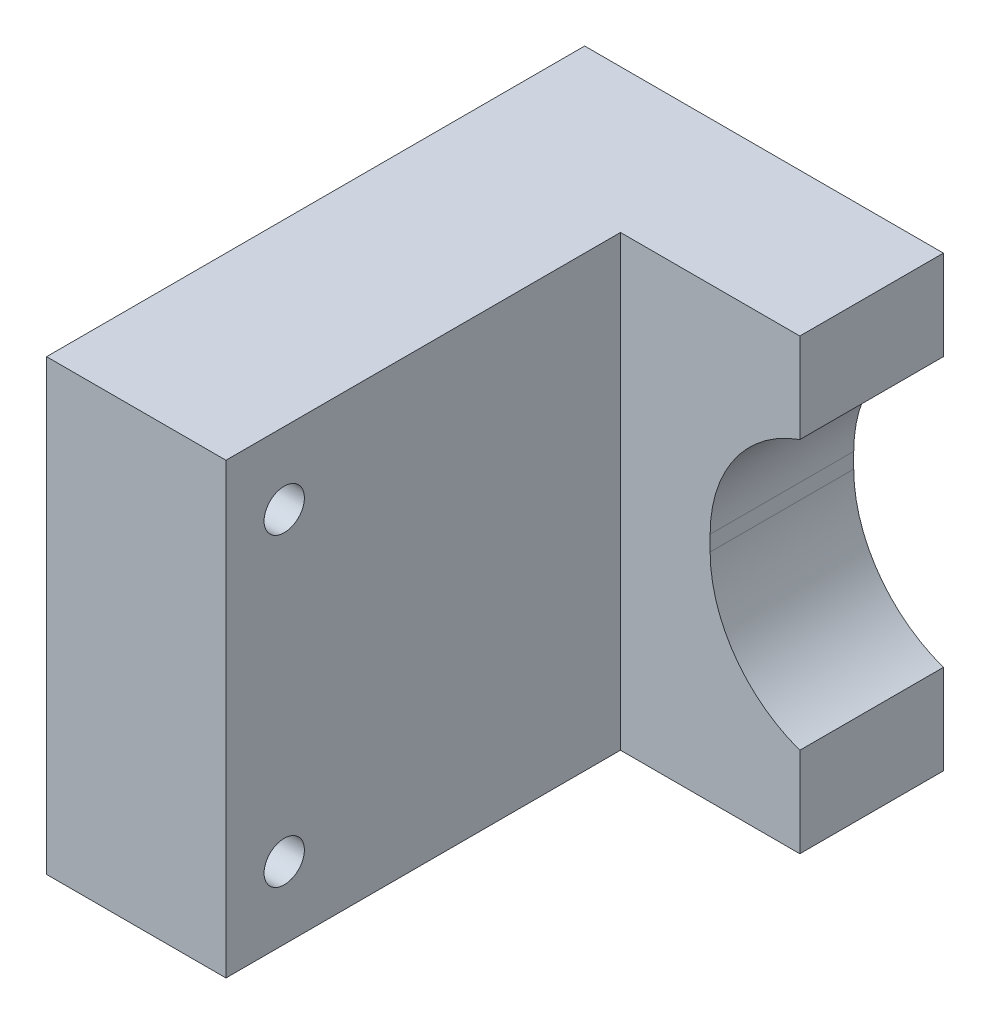
from build123d import *

# Parameters (mm, degrees)
SKETCH3_W                                         = 20
SKETCH3_H                                         = 60
SKETCH3_H_2                                       = 16.009607205
BOSS_EXTRUDE1_DEPTH                               = 50
SKETCH4_W                                         = 16.009607205
SKETCH4_H                                         = 30
CUT_EXTRUDE1_DEPTH                                = 10
FILLET4_R                                         = 15
CSK_FOR_8_FLAT_HEAD_MACHINE_SCREW_100_D           = 4.4958
CSK_FOR_8_FLAT_HEAD_MACHINE_SCREW_100_CSINK_D     = 8.4328
CSK_FOR_8_FLAT_HEAD_MACHINE_SCREW_100_CSINK_ANGLE = 100
SKETCH7_R                                         = 2.5
CUT_EXTRUDE2_DEPTH                                = 30


with BuildPart() as part:
    # Sketch3 → Boss-Extrude1 (new body)
    with BuildSketch(Plane(origin=(0, 0, 0), x_dir=(1, 0, 0), z_dir=(0, 1, 0))):
        Rectangle(SKETCH3_W, SKETCH3_H)
        with Locations((20, 21.995196398)):
            Rectangle(SKETCH3_W, SKETCH3_H_2)
    extrude(amount=BOSS_EXTRUDE1_DEPTH)

    # Sketch4 → Cut-Extrude1 (cut)
    with BuildSketch(Plane(origin=(30, 0, 0), x_dir=(0, 0, -1), z_dir=(1, 0, 0))):
        with Locations((21.995196398, 25)):
            Rectangle(SKETCH4_W, SKETCH4_H)
    extrude(amount=-CUT_EXTRUDE1_DEPTH, mode=Mode.SUBTRACT)

    # Fillet4
    # the kernel refuses this fillet: 15 mm, written as the material it adds along each edge
    with BuildSketch(Plane(origin=(20, 10, -30), x_dir=(1, 0, 0), z_dir=(0, 0, 1))) as fillet4_piece_1:
        with BuildLine():
            CenterArc((15, 14.142135624), FILLET4_R, 180, 70.528779366)
            Line((0, 14.142135624), (-0.3, 14.142135624))
            Line((-0.3, 14.142135624), (-0.3, 0))
            Line((-0.3, 0), (0, -0.3))
            ThreePointArc((0, -0.3), (5, -0.3), (9.9, -0.282842712))
            Line((9.9, -0.282842712), (10, 0))
        make_face()
    extrude(amount=16.009607205)
    with BuildSketch(Plane(origin=(20, 40, -13.990392795), x_dir=(0, -1, 0), z_dir=(0, 0, -1))) as fillet4_piece_2:
        with BuildLine():
            CenterArc((14.142135624, -15), FILLET4_R, 90, 70.528779366)
            Line((0, -10), (-0.282842712, -9.9))
            ThreePointArc((-0.282842712, -9.9), (-0.3, -5), (-0.3, 0))
            Line((-0.3, 0), (0, 0.3))
            Line((0, 0.3), (14.142135624, 0.3))
            Line((14.142135624, 0.3), (14.142135624, 0))
        make_face()
    extrude(amount=16.009607205)

    # CSK for #8 Flat Head Machine Screw (100)1 (through all)
    with Locations(Plane.ZY.offset(10)):
        with Locations((23.5, 8), (23.5, 42)):
            CounterSinkHole(CSK_FOR_8_FLAT_HEAD_MACHINE_SCREW_100_D / 2, CSK_FOR_8_FLAT_HEAD_MACHINE_SCREW_100_CSINK_D / 2, counter_sink_angle=CSK_FOR_8_FLAT_HEAD_MACHINE_SCREW_100_CSINK_ANGLE)

    # Sketch7 → Cut-Extrude2 (cut)
    with BuildSketch(Plane(origin=(0, 0, -30), x_dir=(-1, 0, 0), z_dir=(0, 0, -1))):
        with Locations((0, 10)):
            Circle(SKETCH7_R)
        with Locations((0, 40)):
            Circle(SKETCH7_R)
    extrude(amount=-CUT_EXTRUDE2_DEPTH, mode=Mode.SUBTRACT)


solid = part.part
